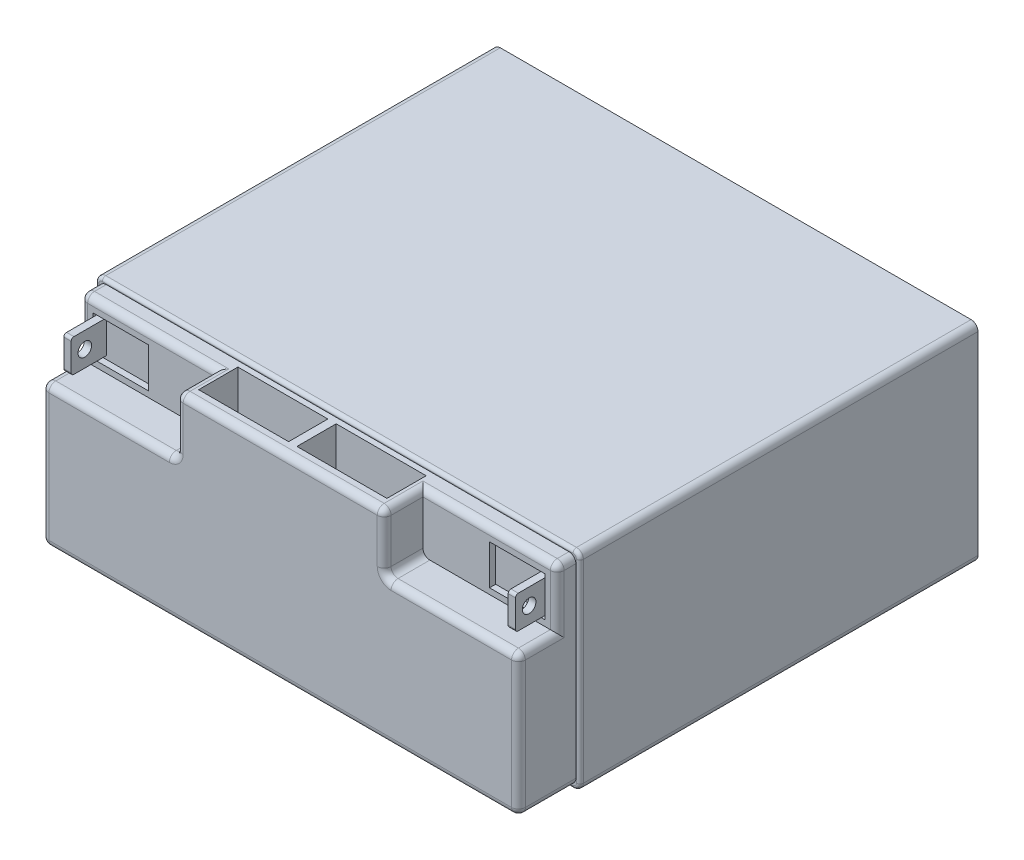
from build123d import *

# Parameters (mm, degrees)
SKETCH1_W                    = 177.8
SKETCH1_H                    = 146.05
BOSS_EXTRUDE1_DEPTH          = 76.2
SKETCH2_W                    = 174.845239449
SKETCH2_H                    = 73.245239449
BOSS_EXTRUDE2_DEPTH          = 21.082
SKETCH3_W                    = 14.224
SKETCH3_H                    = 21.336
CUT_EXTRUDE1_DEPTH           = 49.276
SKETCH4_W                    = 2.693561453
SKETCH4_H                    = 12
BOSS_EXTRUDE3_DEPTH          = 10.746
CUT_EXTRUDE2_DEPTH           = 2.254
SKETCH6_W                    = 49.276
SKETCH6_H                    = 14.224
CUT_EXTRUDE3_DEPTH           = 21.336
SKETCH7_W                    = 2.693561452
SKETCH7_H                    = 12
BOSS_EXTRUDE4_DEPTH          = 10.746
CUT_EXTRUDE4_DEPTH           = 2.254
SKETCH9_W                    = 33.02
SKETCH9_H                    = 14.399652357
CUT_EXTRUDE5_DEPTH           = 19.05
SKETCH10_W                   = 33.02
SKETCH10_H                   = 14.399652357
CUT_EXTRUDE6_DEPTH           = 19.05
SKETCH11_W                   = 63.5
SKETCH11_H                   = 15.201284342
CUT_EXTRUDE7_DEPTH           = 19.558
SKETCH12_W                   = 63.5
SKETCH12_H                   = 15.201284342
CUT_EXTRUDE8_DEPTH           = 19.558
F_5_0_5_DIAMETER_HOLE1_D     = 5
F_5_0_5_DIAMETER_HOLE1_DEPTH = 8.734014926
F_5_0_5_DIAMETER_HOLE2_D     = 5
F_5_0_5_DIAMETER_HOLE2_DEPTH = 8.734014926
FILLET1_R                    = 2.54
FILLET2_R                    = 1
FILLET3_R                    = 1.27


with BuildPart() as part:
    # Sketch1 → Boss-Extrude1 (new body)
    with BuildSketch(Plane.XZ.offset(62.213215728)):
        with Locations((55.786931477, 73.025)):
            Rectangle(SKETCH1_W, SKETCH1_H)
    extrude(amount=-BOSS_EXTRUDE1_DEPTH)

    # Sketch2 → Boss-Extrude2 (add)
    with BuildSketch(Plane.XY.offset(146.05)):
        with Locations((55.786931477, -24.113215728)):
            Rectangle(SKETCH2_W, SKETCH2_H)
    extrude(amount=BOSS_EXTRUDE2_DEPTH)

    # Sketch3 → Cut-Extrude1 (cut)
    with BuildSketch(Plane.ZY.offset(31.635688247)):
        with Locations((160.02, 1.841403997)):
            Rectangle(SKETCH3_W, SKETCH3_H)
    extrude(amount=-CUT_EXTRUDE1_DEPTH, mode=Mode.SUBTRACT)

    # Sketch4 → Boss-Extrude3 (add)
    with BuildSketch(Plane.XY.offset(152.908)):
        with Locations((-25.725834324, 0.632623113)):
            Rectangle(SKETCH4_W, SKETCH4_H)
    extrude(amount=BOSS_EXTRUDE3_DEPTH)

    # Sketch5 → Cut-Extrude2 (cut)
    with BuildSketch(Plane.XY.offset(152.908)):
        Polygon((-27.07261505, 6.632623113), (-24.379053597, 6.632623113), (-24.379053597, -5.367376887), (-27.07261505, -5.367376887), (-27.07261505, -6.677584717), (-6.787176985, -6.677584717), (-6.787176985, 7.942830943), (-27.07261505, 7.942830943), align=None)
    extrude(amount=-CUT_EXTRUDE2_DEPTH, mode=Mode.SUBTRACT)

    # Sketch6 → Cut-Extrude3 (cut)
    with BuildSketch(Plane(origin=(0, 12.509403997, 0), x_dir=(-1, 0, 0), z_dir=(0, 1, 0))):
        with Locations((-118.571551202, 160.02)):
            Rectangle(SKETCH6_W, SKETCH6_H)
    extrude(amount=-CUT_EXTRUDE3_DEPTH, mode=Mode.SUBTRACT)

    # Sketch7 → Boss-Extrude4 (add)
    with BuildSketch(Plane.XY.offset(152.908)):
        with Locations((137.299697278, 0.632623113)):
            Rectangle(SKETCH7_W, SKETCH7_H)
    extrude(amount=BOSS_EXTRUDE4_DEPTH)

    # Sketch8 → Cut-Extrude4 (cut)
    with BuildSketch(Plane.XY.offset(152.908)):
        Polygon((138.646478004, -5.367376887), (135.952916552, -5.367376887), (135.952916552, 6.632623113), (138.646478004, 6.632623113), (138.646478004, 7.942830943), (118.361039939, 7.942830943), (118.361039939, -6.677584717), (138.646478004, -6.677584717), align=None)
    extrude(amount=-CUT_EXTRUDE4_DEPTH, mode=Mode.SUBTRACT)

    # Sketch9 → Cut-Extrude5 (cut)
    with BuildSketch(Plane(origin=(0, 12.509403997, 0), x_dir=(-1, 0, 0), z_dir=(0, 1, 0))):
        with Locations((-73.820931477, 155.313650768)):
            Rectangle(SKETCH9_W, SKETCH9_H)
    extrude(amount=-CUT_EXTRUDE5_DEPTH, mode=Mode.SUBTRACT)

    # Sketch10 → Cut-Extrude6 (cut)
    with BuildSketch(Plane(origin=(0, 12.509403997, 0), x_dir=(-1, 0, 0), z_dir=(0, 1, 0))):
        with Locations((-37.752931477, 155.313650768)):
            Rectangle(SKETCH10_W, SKETCH10_H)
    extrude(amount=-CUT_EXTRUDE6_DEPTH, mode=Mode.SUBTRACT)

    # Sketch11 → Cut-Extrude7 (cut)
    with BuildSketch(Plane.XZ.offset(60.735835452)):
        with Locations((88.599551202, 155.2427389)):
            Rectangle(SKETCH11_W, SKETCH11_H)
    extrude(amount=-CUT_EXTRUDE7_DEPTH, mode=Mode.SUBTRACT)

    # Sketch12 → Cut-Extrude8 (cut)
    with BuildSketch(Plane.XZ.offset(60.735835452)):
        with Locations((22.974311753, 155.2427389)):
            Rectangle(SKETCH12_W, SKETCH12_H)
    extrude(amount=-CUT_EXTRUDE8_DEPTH, mode=Mode.SUBTRACT)

    # Ø5.0 (5) Diameter Hole1
    with Locations(Plane.ZY.offset(-135.952916552)):
        with Locations((158.654, 0.632623113)):
            Hole(F_5_0_5_DIAMETER_HOLE1_D / 2, depth=F_5_0_5_DIAMETER_HOLE1_DEPTH)

    # Ø5.0 (5) Diameter Hole2
    with Locations(Plane(origin=(-24.379053597, 0, 0), x_dir=(0, 0, -1), z_dir=(1, 0, 0))):
        with Locations((-158.654, 0.632623113)):
            Hole(F_5_0_5_DIAMETER_HOLE2_D / 2, depth=F_5_0_5_DIAMETER_HOLE2_DEPTH)

    # Fillet1
    fillet1_edges = [part.edges().sort_by_distance(p)[0] for p in [
        (143.209551202, -60.735835452, 156.591),
        (143.209551202, 1.841403997, 152.908),
        (143.209551202, 12.509403997, 149.479),
        (-31.635688247, -60.735835452, 156.591),
        (55.786931477, -60.735835452, 167.132),
        (143.209551202, -34.781215728, 167.132),
        (143.209551202, -8.826596003, 160.02),
        (118.571551202, 12.509403997, 152.908),
        (-31.635688247, 12.509403997, 149.479),
        (-31.635688247, 1.841403997, 152.908),
        (-31.635688247, -8.826596003, 160.02),
        (-31.635688247, -34.781215728, 167.132),
        (93.933551202, 1.841403997, 167.132),
        (118.571551202, -8.826596003, 167.132),
        (93.933551202, 12.509403997, 160.02),
        (-6.997688247, 12.509403997, 152.908),
        (-6.997688247, -8.826596003, 167.132),
        (17.640311753, 1.841403997, 167.132),
        (55.786931477, 12.509403997, 167.132),
        (17.640311753, 12.509403997, 160.02),
        (17.640311753, -8.826596003, 160.02),
        (-33.113068523, 13.986784272, 73.025),
        (93.933551202, -8.826596003, 160.02),
        (144.686931477, -62.213215728, 73.025),
        (-33.113068523, -62.213215728, 73.025),
        (144.686931477, 13.986784272, 73.025),
    ]]
    fillet(fillet1_edges, radius=FILLET1_R)

    # Fillet2
    fillet2_edges = [part.edges().sort_by_distance(p)[0] for p in [
        (-25.725834323, -5.367376887, 163.654),
        (-25.725834323, 6.632623113, 163.654),
        (137.299697278, 6.632623113, 163.654),
        (137.299697278, -5.367376887, 163.654),
    ]]
    fillet(fillet2_edges, radius=FILLET2_R)

    # Fillet3
    fillet3_edges = [part.edges().sort_by_distance(p)[0] for p in [
        (-33.113068523, -24.113215728, 146.05),
        (-32.369119747, 13.242835496, 146.05),
        (-32.369119747, -61.469266952, 146.05),
        (55.786931477, 13.986784272, 146.05),
        (55.786931477, -62.213215728, 146.05),
        (143.942982701, 13.242835496, 146.05),
        (143.942982701, -61.469266952, 146.05),
        (144.686931477, -24.113215728, 146.05),
    ]]
    fillet(fillet3_edges, radius=FILLET3_R)


solid = part.part
